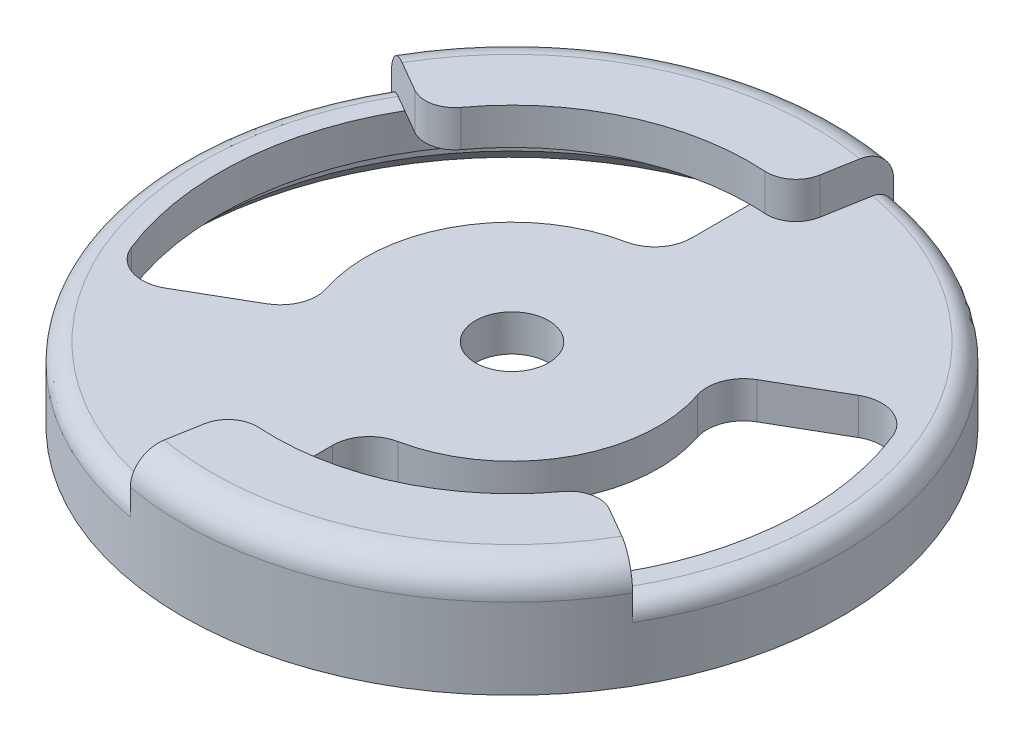
from build123d import *

# Parameters (mm, degrees)
SKETCH_1_R          = 9
EXTRUDE_1_DEPTH     = 2
SKETCH_2_R          = 8.5
CUT_EXTRUDE_1_DEPTH = 1
CHAMFER_1_SIZE      = 0.5
CUT_EXTRUDE_2_DEPTH = 1
FILLET_1_R          = 1
SKETCH_4_R          = 1
CUT_EXTRUDE_3_DEPTH = 13.884098727
EXTRUDE_START       = 1
EXTRUDE_2_DEPTH     = 1
FILLET_3_R          = 0.8
FILLET_4_R          = 0.8
FILLET_5_R          = 0.5


# Some blends are built 0.0001 mm under size
with BuildPart() as part:
    # 草图1 → 凸台-拉伸1 (new body)
    with BuildSketch(Plane(origin=(0, 0, 0), x_dir=(1, 0, 0), z_dir=(0, 1, 0))):
        with Locations(Location((0, 0, 0), (0, 0, 270))):
            Circle(SKETCH_1_R)
    extrude(amount=EXTRUDE_1_DEPTH)

    # 草图2 → 切除-拉伸1 (cut)
    with BuildSketch(Plane.XZ):
        with Locations(Location((0, 0, 0), (0, 0, 270))):
            Circle(SKETCH_2_R)
    extrude(amount=-CUT_EXTRUDE_1_DEPTH, mode=Mode.SUBTRACT)

    # 倒角1
    chamfer_1_edges = [part.edges().sort_by_distance(p)[0] for p in [
        (0, 0, 8.5),
    ]]
    chamfer(chamfer_1_edges, length=CHAMFER_1_SIZE - 0.0001)  # a hair under: the kernel refuses the full size

    # 草图3 → 切除-拉伸2 (cut)
    with BuildSketch(Plane(origin=(0, 2, 0), x_dir=(1, 0, 0), z_dir=(0, 1, 0))):
        with BuildLine():
            Line((0, 4), (0, 8))
            ThreePointArc((0, 8), (-6.92820323, 4), (-6.92820323, -4))
            Line((-6.92820323, -4), (-3.464101615, -2))
            ThreePointArc((-3.464101615, -2), (-3.464101615, 2), (0, 4))
        make_face()
        with BuildLine():
            ThreePointArc((0, -8), (6.92820323, -4), (6.92820323, 4))
            Line((6.92820323, 4), (3.464101615, 2))
            ThreePointArc((3.464101615, 2), (3.464101615, -2), (0, -4))
            Line((0, -4), (0, -8))
        make_face()
    extrude(amount=-CUT_EXTRUDE_2_DEPTH, mode=Mode.SUBTRACT)

    # 圆角1
    fillet_1_edges = [part.edges().sort_by_distance(p)[0] for p in [
        (0, 1.5, -8),
        (0, 1.5, -4),
        (-3.464101615, 1.5, 2),
        (-6.92820323, 1.5, 4),
        (0, 1.5, 8),
        (0, 1.5, 4),
        (3.464101615, 1.5, -2),
        (6.92820323, 1.5, -4),
    ]]
    fillet(fillet_1_edges, radius=FILLET_1_R)

    # 草图4 → 切除-拉伸3 (cut, through all)
    with BuildSketch(Plane(origin=(0, 2, 0), x_dir=(1, 0, 0), z_dir=(0, 1, 0))):
        with Locations(Location((0, 0, 0), (0, 0, 270))):
            Circle(SKETCH_4_R)
    extrude(amount=-CUT_EXTRUDE_3_DEPTH, mode=Mode.SUBTRACT)

    # 草图5 → 凸台-拉伸2 (add)
    with BuildSketch(Plane(origin=(0, 2, 0), x_dir=(1, 0, 0), z_dir=(0, 1, 0)).offset(EXTRUDE_START)):
        with BuildLine():
            ThreePointArc((1.562833599, 8.863269777), (-3.803564356, 8.156770083), (-7.794228634, 4.5))
            Line((-7.794228634, 4.5), (-6.92820323, 4))
            ThreePointArc((-6.92820323, 4), (-4.485875631, 6.623965566), (-1.142857143, 7.917946549))
            ThreePointArc((-1.142857143, 7.917946549), (-0.345346329, 7.684132176), (0, 6.92820323))
            Line((0, 6.92820323), (0, 6.5))
            ThreePointArc((0, 6.5), (0.566512328, 6.475265538), (1.128713155, 6.401250395))
            Line((1.128713155, 6.401250395), (1.562833599, 8.863269777))
        make_face()
        with BuildLine():
            ThreePointArc((-1.142857143, 7.917946549), (-4.485875631, 6.623965566), (-6.92820323, 4))
            Line((-6.92820323, 4), (-5.629165125, 3.25))
            ThreePointArc((-5.629165125, 3.25), (-3.25, 5.629165125), (0, 6.5))
            Line((0, 6.5), (0, 6.92820323))
            ThreePointArc((0, 6.92820323), (-0.345346329, 7.684132176), (-1.142857143, 7.917946549))
        make_face()
        with BuildLine():
            ThreePointArc((5.629165125, -3.25), (3.25, -5.629165125), (0, -6.5))
            Line((0, -6.5), (0, -6.92820323))
            ThreePointArc((0, -6.92820323), (0.345346329, -7.684132176), (1.142857143, -7.917946549))
            ThreePointArc((1.142857143, -7.917946549), (4.485875631, -6.623965566), (6.92820323, -4))
            Line((6.92820323, -4), (5.629165125, -3.25))
        make_face()
        with BuildLine():
            Line((-1.128713155, -6.401250395), (-1.562833599, -8.863269777))
            ThreePointArc((-1.562833599, -8.863269777), (3.803564356, -8.156770083), (7.794228634, -4.5))
            Line((7.794228634, -4.5), (6.92820323, -4))
            ThreePointArc((6.92820323, -4), (4.485875631, -6.623965566), (1.142857143, -7.917946549))
            ThreePointArc((1.142857143, -7.917946549), (0.345346329, -7.684132176), (0, -6.92820323))
            Line((0, -6.92820323), (0, -6.5))
            ThreePointArc((0, -6.5), (-0.566512328, -6.475265538), (-1.128713155, -6.401250395))
        make_face()
    extrude(amount=-EXTRUDE_2_DEPTH)

    # 圆角3
    fillet_3_edges = [part.edges().sort_by_distance(p)[0] for p in [
        (-3.803564356, 3, -8.156770083),
        (3.803564356, 3, 8.156770083),
    ]]
    fillet(fillet_3_edges, radius=FILLET_3_R)

    # 圆角4
    fillet_4_edges = [part.edges().sort_by_distance(p)[0] for p in [
        (-5.629165125, 2.5, -3.25),
        (1.128713155, 2.5, -6.401250395),
        (5.629165125, 2.5, 3.25),
        (-1.128713155, 2.5, 6.401250395),
    ]]
    fillet(fillet_4_edges, radius=FILLET_4_R)

    # 圆角5
    # the kernel refuses this fillet: 0.5 mm, written as the material it takes off along each edge
    with BuildSketch(Plane(origin=(0, 2, 0), x_dir=(-0.8660254037844409, 0, -0.49999999999999595), z_dir=(0.49999999999999595, 0, -0.8660254037844409))) as fillet_5_piece_1:
        with BuildLine():
            CenterArc((9 - FILLET_5_R, -FILLET_5_R), FILLET_5_R, 0, 90)
            Line((9 - FILLET_5_R, 0), (9, 0))
            Line((9, 0), (9, -FILLET_5_R))
        make_face()
    revolve(axis=Axis((0, 2, 0), (0, 1, 0)), revolution_arc=110, mode=Mode.SUBTRACT)
    with BuildSketch(Plane(origin=(0, 2, 0), x_dir=(0.866025403784441, 0, 0.49999999999999584), z_dir=(-0.49999999999999584, 0, 0.866025403784441))) as fillet_5_piece_2:
        with BuildLine():
            CenterArc((9 - FILLET_5_R, -FILLET_5_R), FILLET_5_R, 0, 90)
            Line((9 - FILLET_5_R, 0), (9, 0))
            Line((9, 0), (9, -FILLET_5_R))
        make_face()
    revolve(axis=Axis((0, 2, 0), (0, 1, 0)), revolution_arc=110, mode=Mode.SUBTRACT)


solid = part.part
